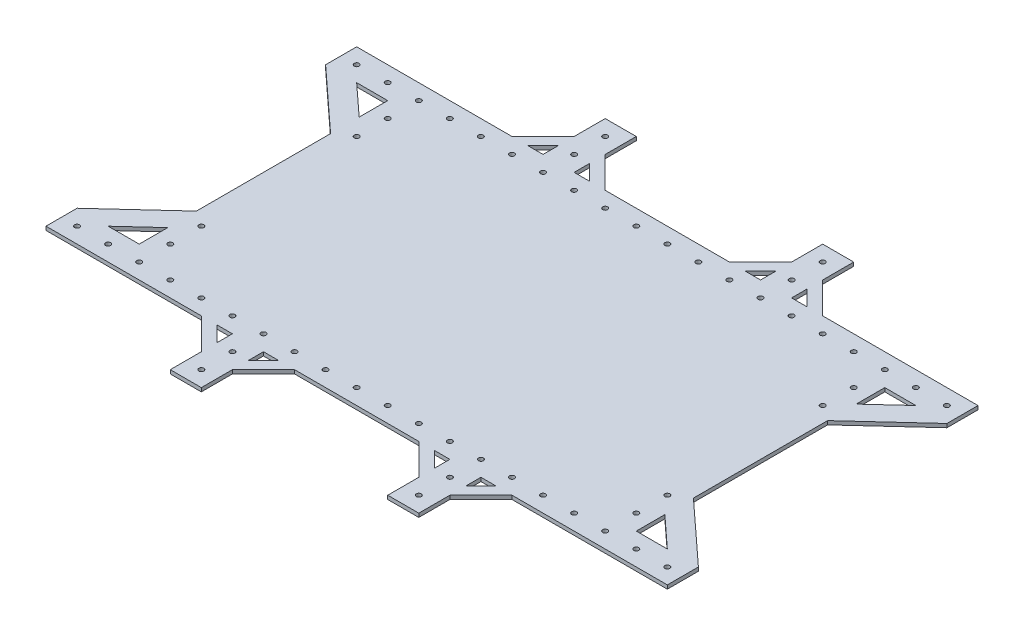
from build123d import *

# Parameters (mm, degrees)
BOSS_EXTRUDE1_DEPTH = 3
BOSS_EXTRUDE2_DEPTH = 3
BOSS_EXTRUDE3_DEPTH = 3
SKETCH4_R           = 2
CUT_EXTRUDE1_DEPTH  = 3


with BuildPart() as part:
    # Sketch1 → Boss-Extrude1 (new body)
    with BuildSketch(Plane(origin=(0, 0, 0), x_dir=(1, 0, 0), z_dir=(0, 1, 0))):
        Polygon((-75, 125), (75, 125), (75, 175), (100, 175), (100, 125), (250, 125), (250, 100), (200, 100), (200, -100), (250, -100), (250, -125), (100, -125), (100, -175), (75, -175), (75, -125), (-75, -125), (-75, -175), (-100, -175), (-100, -125), (-250, -125), (-250, -100), (-200, -100), (-200, 100), (-250, 100), (-250, 125), (-100, 125), (-100, 175), (-75, 175), align=None)
    extrude(amount=BOSS_EXTRUDE1_DEPTH)

    # Sketch2 → Boss-Extrude2 (add)
    with BuildSketch(Plane(origin=(0, 3, 0), x_dir=(1, 0, 0), z_dir=(0, 1, 0))):
        Polygon((-100, 150), (-125, 125), (-112.5, 125), (-100, 137.5), align=None)
        Polygon((-75, 150), (-50, 125), (-62.5, 125), (-75, 137.5), align=None)
        Polygon((75, 150), (50, 125), (62.5, 125), (75, 137.5), align=None)
        Polygon((100, 150), (125, 125), (112.5, 125), (100, 137.5), align=None)
        Polygon((-75, -150), (-50, -125), (-62.5, -125), (-75, -137.5), align=None)
        Polygon((-100, -150), (-125, -125), (-112.5, -125), (-100, -137.5), align=None)
        Polygon((75, -150), (50, -125), (62.5, -125), (75, -137.5), align=None)
        Polygon((100, -150), (125, -125), (112.5, -125), (100, -137.5), align=None)
    extrude(amount=-BOSS_EXTRUDE2_DEPTH)

    # Sketch3 → Boss-Extrude3 (add)
    with BuildSketch(Plane(origin=(0, 3, 0), x_dir=(1, 0, 0), z_dir=(0, 1, 0))):
        Polygon((-250, 100), (-200, 54), (-200, 77), (-225, 100), align=None)
        Polygon((250, 100), (200, 54), (200, 77), (225, 100), align=None)
        Polygon((-250, -100), (-200, -54), (-200, -77), (-225, -100), align=None)
        Polygon((250, -100), (200, -54), (200, -77), (225, -100), align=None)
    extrude(amount=-BOSS_EXTRUDE3_DEPTH)

    # Sketch4 → Cut-Extrude1 (cut)
    with BuildSketch(Plane(origin=(0, 3, 0), x_dir=(1, 0, 0), z_dir=(0, 1, 0))):
        with Locations((-237.5, 112.5)):
            Circle(SKETCH4_R)
        with Locations((-212.5, 112.5)):
            Circle(SKETCH4_R)
        with Locations((-187.5, 112.5)):
            Circle(SKETCH4_R)
        with Locations((-162.5, 112.5)):
            Circle(SKETCH4_R)
        with Locations((-137.5, 112.5)):
            Circle(SKETCH4_R)
        with Locations((-112.5, 112.5)):
            Circle(SKETCH4_R)
        with Locations((-87.5, 112.5)):
            Circle(SKETCH4_R)
        with Locations((-62.5, 112.5)):
            Circle(SKETCH4_R)
        with Locations((-37.5, 112.5)):
            Circle(SKETCH4_R)
        with Locations((-12.5, 112.5)):
            Circle(SKETCH4_R)
        with Locations((12.5, 112.5)):
            Circle(SKETCH4_R)
        with Locations((37.5, 112.5)):
            Circle(SKETCH4_R)
        with Locations((62.5, 112.5)):
            Circle(SKETCH4_R)
        with Locations((87.5, 112.5)):
            Circle(SKETCH4_R)
        with Locations((112.5, 112.5)):
            Circle(SKETCH4_R)
        with Locations((137.5, 112.5)):
            Circle(SKETCH4_R)
        with Locations((162.5, 112.5)):
            Circle(SKETCH4_R)
        with Locations((187.5, 112.5)):
            Circle(SKETCH4_R)
        with Locations((212.5, 112.5)):
            Circle(SKETCH4_R)
        with Locations((237.5, 112.5)):
            Circle(SKETCH4_R)
        with Locations((-237.5, -112.5)):
            Circle(SKETCH4_R)
        with Locations((-212.5, -112.5)):
            Circle(SKETCH4_R)
        with Locations((-187.5, -112.5)):
            Circle(SKETCH4_R)
        with Locations((-162.5, -112.5)):
            Circle(SKETCH4_R)
        with Locations((-137.5, -112.5)):
            Circle(SKETCH4_R)
        with Locations((-112.5, -112.5)):
            Circle(SKETCH4_R)
        with Locations((-87.5, -112.5)):
            Circle(SKETCH4_R)
        with Locations((-62.5, -112.5)):
            Circle(SKETCH4_R)
        with Locations((-37.5, -112.5)):
            Circle(SKETCH4_R)
        with Locations((-12.5, -112.5)):
            Circle(SKETCH4_R)
        with Locations((12.5, -112.5)):
            Circle(SKETCH4_R)
        with Locations((37.5, -112.5)):
            Circle(SKETCH4_R)
        with Locations((62.5, -112.5)):
            Circle(SKETCH4_R)
        with Locations((87.5, -112.5)):
            Circle(SKETCH4_R)
        with Locations((112.5, -112.5)):
            Circle(SKETCH4_R)
        with Locations((137.5, -112.5)):
            Circle(SKETCH4_R)
        with Locations((162.5, -112.5)):
            Circle(SKETCH4_R)
        with Locations((187.5, -112.5)):
            Circle(SKETCH4_R)
        with Locations((212.5, -112.5)):
            Circle(SKETCH4_R)
        with Locations((237.5, -112.5)):
            Circle(SKETCH4_R)
        with Locations((-187.5, 87.5)):
            Circle(SKETCH4_R)
        with Locations((-187.5, 62.5)):
            Circle(SKETCH4_R)
        with Locations((-87.5, 137.5)):
            Circle(SKETCH4_R)
        with Locations((-87.5, 162.5)):
            Circle(SKETCH4_R)
        with Locations((87.5, 137.5)):
            Circle(SKETCH4_R)
        with Locations((87.5, 162.5)):
            Circle(SKETCH4_R)
        with Locations((187.5, 87.5)):
            Circle(SKETCH4_R)
        with Locations((187.5, 62.5)):
            Circle(SKETCH4_R)
        with Locations((-187.5, -87.5)):
            Circle(SKETCH4_R)
        with Locations((-187.5, -62.5)):
            Circle(SKETCH4_R)
        with Locations((-87.5, -137.5)):
            Circle(SKETCH4_R)
        with Locations((-87.5, -162.5)):
            Circle(SKETCH4_R)
        with Locations((87.5, -137.5)):
            Circle(SKETCH4_R)
        with Locations((87.5, -162.5)):
            Circle(SKETCH4_R)
        with Locations((187.5, -87.5)):
            Circle(SKETCH4_R)
        with Locations((187.5, -62.5)):
            Circle(SKETCH4_R)
    extrude(amount=-CUT_EXTRUDE1_DEPTH, mode=Mode.SUBTRACT)


solid = part.part
